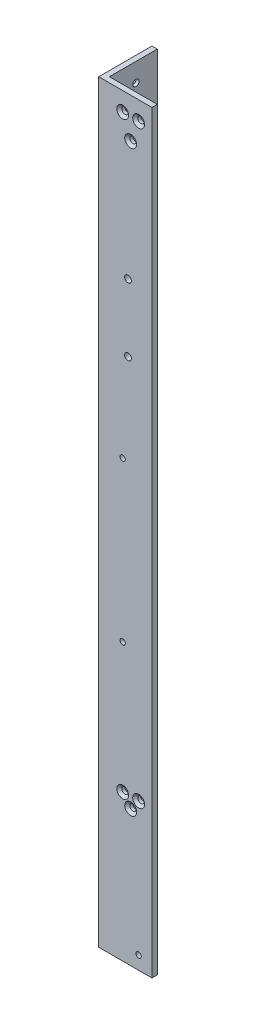
from build123d import *

# Parameters (mm, degrees)
BOSS_EXTRUDE1_DEPTH                               = 450
FRONTSIDEHOLES_SKETCH3_R                          = 1.5875
FRONTSIDEHOLES_SKETCH3_R_2                        = 2
FRONTSIDEHOLES_CUT_EXTRUDE1_DEPTH                 = 3.175
LEFTSIDEHOLES_SKETCH4_R                           = 1.5875
LEFTSIDEHOLES_CUT_EXTRUDE2_DEPTH                  = 3.175
CSK_FOR_6_FLAT_HEAD_MACHINE_SCREW_100_D           = 3.7973
CSK_FOR_6_FLAT_HEAD_MACHINE_SCREW_100_CSINK_D     = 7.0866
CSK_FOR_6_FLAT_HEAD_MACHINE_SCREW_100_CSINK_ANGLE = 100
CSK_FOR_6_FLAT_HEAD_MACHINE_SCREW_2_D             = 3.7973
CSK_FOR_6_FLAT_HEAD_MACHINE_SCREW_2_CSINK_D       = 7.0866
CSK_FOR_6_FLAT_HEAD_MACHINE_SCREW_2_CSINK_ANGLE   = 100


with BuildPart() as part:
    # Sketch2 → Boss-Extrude1 (new body)
    with BuildSketch(Plane(origin=(0, 0, 0), x_dir=(1, 0, 0), z_dir=(0, 1, 0))):
        Polygon((0, 31.75), (3.175, 31.75), (3.175, 3.175), (31.75, 3.175), (31.75, 0), (0, 0), align=None)
    extrude(amount=BOSS_EXTRUDE1_DEPTH)

    # FrontSideHoles-Sketch3 → FrontSideHoles-Cut-Extrude1 (cut)
    with BuildSketch(Plane.XY):
        with Locations((19.05, 81.1125)):
            Circle(FRONTSIDEHOLES_SKETCH3_R)
        with Locations((14.2875, 87.4625)):
            Circle(FRONTSIDEHOLES_SKETCH3_R)
        with Locations((23.8125, 87.4625)):
            Circle(FRONTSIDEHOLES_SKETCH3_R)
        with Locations((14.2875, 438.8875)):
            Circle(FRONTSIDEHOLES_SKETCH3_R)
        with Locations((23.8125, 438.8875)):
            Circle(FRONTSIDEHOLES_SKETCH3_R)
        with Locations((19.05, 426.1875)):
            Circle(FRONTSIDEHOLES_SKETCH3_R)
        with Locations((17.4625, 354.18487)):
            Circle(FRONTSIDEHOLES_SKETCH3_R_2)
        with Locations((17.4625, 313.98487)):
            Circle(FRONTSIDEHOLES_SKETCH3_R_2)
        with Locations((14.2875, 260)):
            Circle(FRONTSIDEHOLES_SKETCH3_R)
        with Locations((14.2875, 165)):
            Circle(FRONTSIDEHOLES_SKETCH3_R)
        with Locations((23.8125, 7.9375)):
            Circle(FRONTSIDEHOLES_SKETCH3_R)
    extrude(amount=-FRONTSIDEHOLES_CUT_EXTRUDE1_DEPTH, mode=Mode.SUBTRACT)

    # LeftSideHoles-Sketch4 → LeftSideHoles-Cut-Extrude2 (cut)
    with BuildSketch(Plane.ZY):
        with Locations((-23.8125, 81.1125)):
            Circle(LEFTSIDEHOLES_SKETCH4_R)
        with Locations((-14.2875, 81.1125)):
            Circle(LEFTSIDEHOLES_SKETCH4_R)
        with Locations((-19.05, 87.4625)):
            Circle(LEFTSIDEHOLES_SKETCH4_R)
        with Locations((-19.05, 438.8875)):
            Circle(LEFTSIDEHOLES_SKETCH4_R)
        with Locations((-23.8125, 426.1875)):
            Circle(LEFTSIDEHOLES_SKETCH4_R)
        with Locations((-14.2875, 426.1875)):
            Circle(LEFTSIDEHOLES_SKETCH4_R)
        with Locations((-23.8125, 341.24737)):
            Circle(LEFTSIDEHOLES_SKETCH4_R)
        with Locations((-14.2875, 341.24737)):
            Circle(LEFTSIDEHOLES_SKETCH4_R)
        with Locations((-23.8125, 306.32237)):
            Circle(LEFTSIDEHOLES_SKETCH4_R)
        with Locations((-14.2875, 306.32237)):
            Circle(LEFTSIDEHOLES_SKETCH4_R)
        with Locations((-23.8125, 7.9375)):
            Circle(LEFTSIDEHOLES_SKETCH4_R)
        with Locations((-14.2875, 165)):
            Circle(LEFTSIDEHOLES_SKETCH4_R)
        with Locations((-14.2875, 260)):
            Circle(LEFTSIDEHOLES_SKETCH4_R)
        with Locations((-14.2875, 355)):
            Circle(LEFTSIDEHOLES_SKETCH4_R)
    extrude(amount=-LEFTSIDEHOLES_CUT_EXTRUDE2_DEPTH, mode=Mode.SUBTRACT)

    # CSK for _6 Flat Head Machine Screw _100 (through all)
    with Locations(Plane.XY):
        with Locations((14.2875, 87.4625), (19.05, 81.1125), (23.8125, 87.4625), (19.05, 426.1875), (14.2875, 438.8875), (23.8125, 438.8875)):
            CounterSinkHole(CSK_FOR_6_FLAT_HEAD_MACHINE_SCREW_100_D / 2, CSK_FOR_6_FLAT_HEAD_MACHINE_SCREW_100_CSINK_D / 2, counter_sink_angle=CSK_FOR_6_FLAT_HEAD_MACHINE_SCREW_100_CSINK_ANGLE)

    # CSK for _6 Flat Head Machine Screw _ 2 (through all)
    with Locations(Plane.ZY):
        with Locations((-19.05, 87.4625), (-23.8125, 81.1125), (-14.2875, 81.1125), (-23.8125, 341.24737), (-14.2875, 341.24737), (-14.2875, 306.32237), (-23.8125, 306.32237), (-23.8125, 426.1875), (-14.2875, 426.1875), (-19.05, 438.8875)):
            CounterSinkHole(CSK_FOR_6_FLAT_HEAD_MACHINE_SCREW_2_D / 2, CSK_FOR_6_FLAT_HEAD_MACHINE_SCREW_2_CSINK_D / 2, counter_sink_angle=CSK_FOR_6_FLAT_HEAD_MACHINE_SCREW_2_CSINK_ANGLE)


solid = part.part
